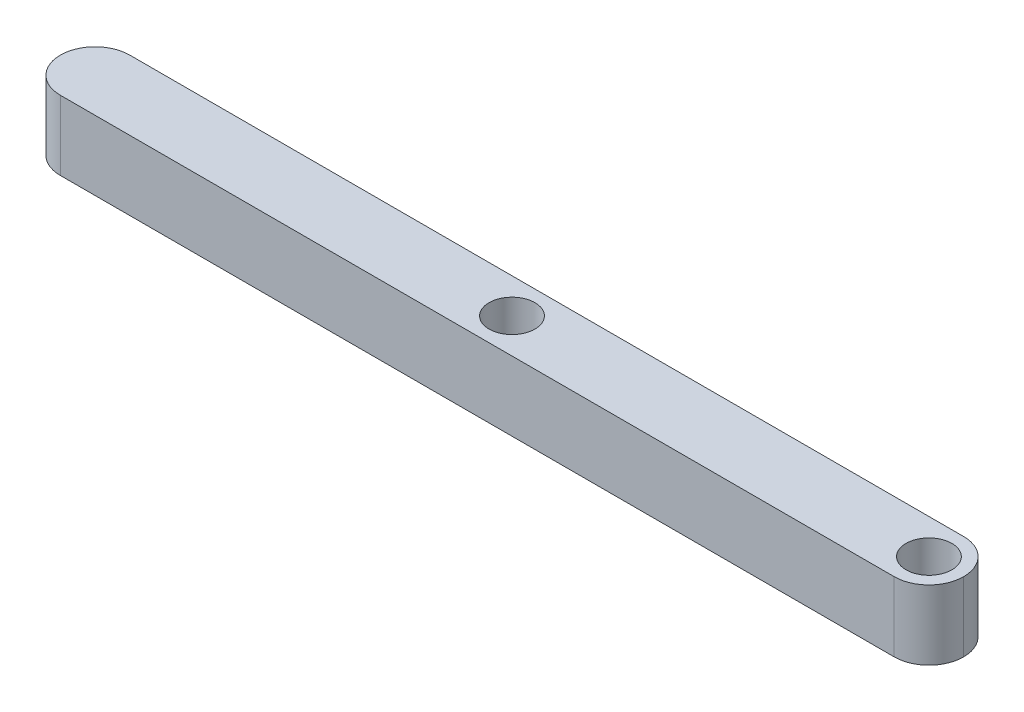
from build123d import *

# Parameters (mm, degrees)
SKETCH_1_W      = 650
SKETCH_1_H      = 50
SKETCH_1_R      = 16.5
EXTRUDE_1_DEPTH = 50
FILLET_1_R      = 25


with BuildPart() as part:
    # 草图1 → 凸台-拉伸1 (new body)
    with BuildSketch(Plane(origin=(0, 0, 0), x_dir=(1, 0, 0), z_dir=(0, 1, 0))):
        with Locations((325, 25)):
            Rectangle(SKETCH_1_W, SKETCH_1_H)
        with Locations(Location((625, 25, 0), (0, 0, 270))):
            Circle(SKETCH_1_R, mode=Mode.SUBTRACT)
        with Locations(Location((325, 25, 0), (0, 0, 270))):
            Circle(SKETCH_1_R, mode=Mode.SUBTRACT)
    extrude(amount=EXTRUDE_1_DEPTH)

    # 圆角1
    fillet_1_edges = [part.edges().sort_by_distance(p)[0] for p in [
        (0, 25, -50),
        (0, 25, 0),
        (650, 25, -50),
        (650, 25, 0),
    ]]
    fillet(fillet_1_edges, radius=FILLET_1_R - 0.0001)  # a hair under: the kernel refuses the full size


solid = part.part
